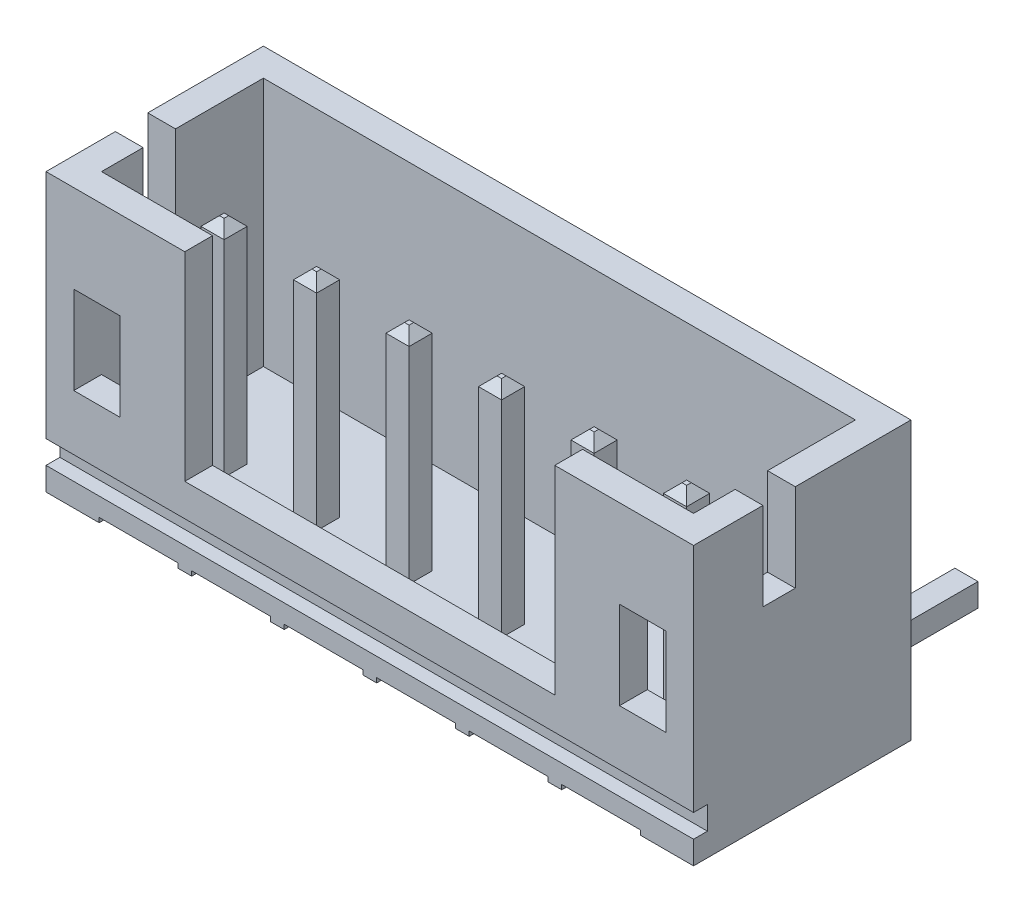
from build123d import *

# Parameters (mm, degrees)
SKETCH_1_W             = 14
SKETCH_1_H             = 4.7
EXTRUDE_1_DEPTH        = 6
SHELL_1_T              = -0.6
SKETCH_2_W             = 8
SKETCH_2_H             = 4.3
CUT_EXTRUDE_1_DEPTH    = 1
SKETCH_3_W             = 1
SKETCH_3_H             = 1.9
CUT_EXTRUDE_2_DEPTH    = 1
CUT_EXTRUDE_3_REACH    = 17.412
SKETCH_4_W             = 0.7
SKETCH_4_H             = 1.9
SKETCH_5_W             = 1.7
SKETCH_5_H             = 0.1
CUT_EXTRUDE_4_DEPTH    = 4.7
PATTERN_LINEAR_1_COUNT = 6
PATTERN_LINEAR_1_PITCH = 2
SKETCH_7_W             = 1.7
SKETCH_7_H             = 0.4
CUT_EXTRUDE_5_DEPTH    = 3.1
SKETCH_8_W             = 0.3
SKETCH_8_H             = 0.5
CUT_EXTRUDE_6_DEPTH    = 14
PATTERN_LINEAR_2_COUNT = 6
PATTERN_LINEAR_2_PITCH = 2
EXTRUDE_1_2_DEPTH      = 0.25
PATTERN_LINEAR_3_COUNT = 6
PATTERN_LINEAR_3_PITCH = 2
FILLET_1_R             = 0.1
CHAMFER_1_SIZE         = 0.2
SKETCH_9_R             = 0.029630404
SKETCH_9_R_2           = 0.02219228
CUT_EXTRUDE_7_DEPTH    = 2


with BuildPart() as part:
    # 草图1 → Extrude 1 (new body)
    with BuildSketch(Plane(origin=(0, 0, 0), x_dir=(1, 0, 0), z_dir=(0, 1, 0))):
        Rectangle(SKETCH_1_W, SKETCH_1_H)
    extrude(amount=EXTRUDE_1_DEPTH)

    # 抽壳1
    shell_1_openings = [part.faces().sort_by_distance(p)[0] for p in [
        (0, 6, 0),
    ]]
    offset(amount=SHELL_1_T, openings=shell_1_openings, kind=Kind.INTERSECTION)

    # 草图2 → 切除-拉伸1 (cut)
    with BuildSketch(Plane.XY.offset(2.35)):
        with Locations((0, 3.85)):
            Rectangle(SKETCH_2_W, SKETCH_2_H)
    extrude(amount=-CUT_EXTRUDE_1_DEPTH, mode=Mode.SUBTRACT)

    # 草图3 → 切除-拉伸2 (cut)
    with BuildSketch(Plane.XY.offset(2.35)):
        with Locations((-5.9, 3.15)):
            Rectangle(SKETCH_3_W, SKETCH_3_H)
    cut_extrude_2 = extrude(amount=-CUT_EXTRUDE_2_DEPTH, mode=Mode.SUBTRACT)

    # 镜向1: 切除-拉伸2 across plane
    add(cut_extrude_2.mirror(Plane(origin=(0, 0, 0), x_dir=(0, 0, 1), z_dir=(1, 0, 0))), mode=Mode.SUBTRACT)

    # 切除-拉伸3: up to this face of the body (flat: up to its plane)
    cut_extrude_3_end = Plane(part.part.faces().sort_by_distance((7, 3, 0))[0])
    # 草图4 → 切除-拉伸3 (cut, up to the picked face)
    with BuildSketch(Plane.ZY.offset(7), mode=Mode.PRIVATE) as cut_extrude_3_sk1:
        with Locations((0.5, 5.05)):
            Rectangle(SKETCH_4_W, SKETCH_4_H)
    cut_extrude_3_tool1 = split(extrude(cut_extrude_3_sk1.sketch, amount=-CUT_EXTRUDE_3_REACH, mode=Mode.PRIVATE), bisect_by=cut_extrude_3_end, keep=Keep.BOTH, mode=Mode.PRIVATE)
    add(cut_extrude_3_tool1.solids().sort_by(Axis((-7, 5.05, 0.5), (1, 0, 0)))[0], mode=Mode.SUBTRACT)

    # 草图5 → 切除-拉伸4 (cut)
    with BuildSketch(Plane.XY.offset(2.35)):
        with Locations((-5, 0.05)):
            Rectangle(SKETCH_5_W, SKETCH_5_H)
    cut_extrude_4 = extrude(amount=-CUT_EXTRUDE_4_DEPTH, mode=Mode.SUBTRACT)

    # 阵列(线性)1: 切除-拉伸4 ×6
    with Locations(*[(i * PATTERN_LINEAR_1_PITCH, 0, 0) for i in range(1, PATTERN_LINEAR_1_COUNT)]):
        add(cut_extrude_4, mode=Mode.SUBTRACT)

    # 草图7 → 切除-拉伸5 (cut)
    with BuildSketch(Plane(origin=(0, 0, -2.35), x_dir=(-1, 0, 0), z_dir=(0, 0, -1))):
        with Locations((-5, 0.3)):
            Rectangle(SKETCH_7_W, SKETCH_7_H)
    cut_extrude_5 = extrude(amount=-CUT_EXTRUDE_5_DEPTH, mode=Mode.SUBTRACT)

    # 草图8 → 切除-拉伸6 (cut)
    with BuildSketch(Plane.ZY.offset(7)):
        with Locations((2.2, 0.75)):
            Rectangle(SKETCH_8_W, SKETCH_8_H)
    extrude(amount=-CUT_EXTRUDE_6_DEPTH, mode=Mode.SUBTRACT)

    # 阵列(线性)2: 切除-拉伸5 ×6
    with Locations(*[(-i * PATTERN_LINEAR_2_PITCH, 0, 0) for i in range(1, PATTERN_LINEAR_2_COUNT)]):
        add(cut_extrude_5, mode=Mode.SUBTRACT)

    # 草图6 → Extrude 1 2 (add, symmetric)
    with BuildSketch(Plane(origin=(5, 0, 0), x_dir=(0, 0, -1), z_dir=(1, 0, 0))):
        Polygon((-0.75, 5.25), (-0.75, 0), (5.75, 0), (5.75, 0.5), (-0.25, 0.5), (-0.25, 5.25), align=None)
    extrude_1_2 = extrude(amount=EXTRUDE_1_2_DEPTH, both=True)

    # 阵列(线性)3: Extrude 1 2 ×6
    with Locations(*[(-i * PATTERN_LINEAR_3_PITCH, 0, 0) for i in range(1, PATTERN_LINEAR_3_COUNT)]):
        add(extrude_1_2)

    # 圆角1
    fillet_1_edges = [part.edges().sort_by_distance(p)[0] for p in [
        (5, 0, 0.75),
        (-5, 0, 0.75),
        (-3, 0, 0.75),
        (-1, 0, 0.75),
        (1, 0, 0.75),
        (3, 0, 0.75),
    ]]
    fillet(fillet_1_edges, radius=FILLET_1_R - 0.0001)  # a hair under: the kernel refuses the full size

    # 倒角1
    chamfer_1_edges = [part.edges().sort_by_distance(p)[0] for p in [
        (5, 0.5, -5.75),
        (4.75, 0.25, -5.75),
        (5.25, 0.25, -5.75),
        (5, 0, -5.75),
        (5.25, 5.25, 0.5),
        (5, 5.25, 0.25),
        (5, 5.25, 0.75),
        (4.75, 5.25, 0.5),
        (3, 0.5, -5.75),
        (2.75, 0.25, -5.75),
        (3.25, 0.25, -5.75),
        (3, 0, -5.75),
        (3.25, 5.25, 0.5),
        (3, 5.25, 0.25),
        (3, 5.25, 0.75),
        (2.75, 5.25, 0.5),
        (1, 0.5, -5.75),
        (0.75, 0.25, -5.75),
        (1.25, 0.25, -5.75),
        (1, 0, -5.75),
        (1.25, 5.25, 0.5),
        (1, 5.25, 0.25),
        (1, 5.25, 0.75),
        (0.75, 5.25, 0.5),
        (-1, 0.5, -5.75),
        (-1.25, 0.25, -5.75),
        (-0.75, 0.25, -5.75),
        (-1, 0, -5.75),
        (-0.75, 5.25, 0.5),
        (-1, 5.25, 0.25),
        (-1, 5.25, 0.75),
        (-1.25, 5.25, 0.5),
        (-3, 0.5, -5.75),
        (-3.25, 0.25, -5.75),
        (-2.75, 0.25, -5.75),
        (-3, 0, -5.75),
        (-2.75, 5.25, 0.5),
        (-3, 5.25, 0.25),
        (-3, 5.25, 0.75),
        (-3.25, 5.25, 0.5),
        (-5, 0.5, -5.75),
        (-5.25, 0.25, -5.75),
        (-4.75, 0.25, -5.75),
        (-5, 0, -5.75),
        (-4.75, 5.25, 0.5),
        (-5, 5.25, 0.25),
        (-5, 5.25, 0.75),
        (-5.25, 5.25, 0.5),
    ]]
    chamfer(chamfer_1_edges, length=CHAMFER_1_SIZE)

    # 草图9 → 切除-拉伸7 (cut)
    with BuildSketch(Plane(origin=(0, 0, -5.75), x_dir=(-1, 0, 0), z_dir=(0, 0, -1))):
        with Locations((-5, 0.25)):
            Circle(SKETCH_9_R)
        with Locations((5, 0.25)):
            Circle(SKETCH_9_R_2)
    extrude(amount=-CUT_EXTRUDE_7_DEPTH, mode=Mode.SUBTRACT)


solid = part.part
